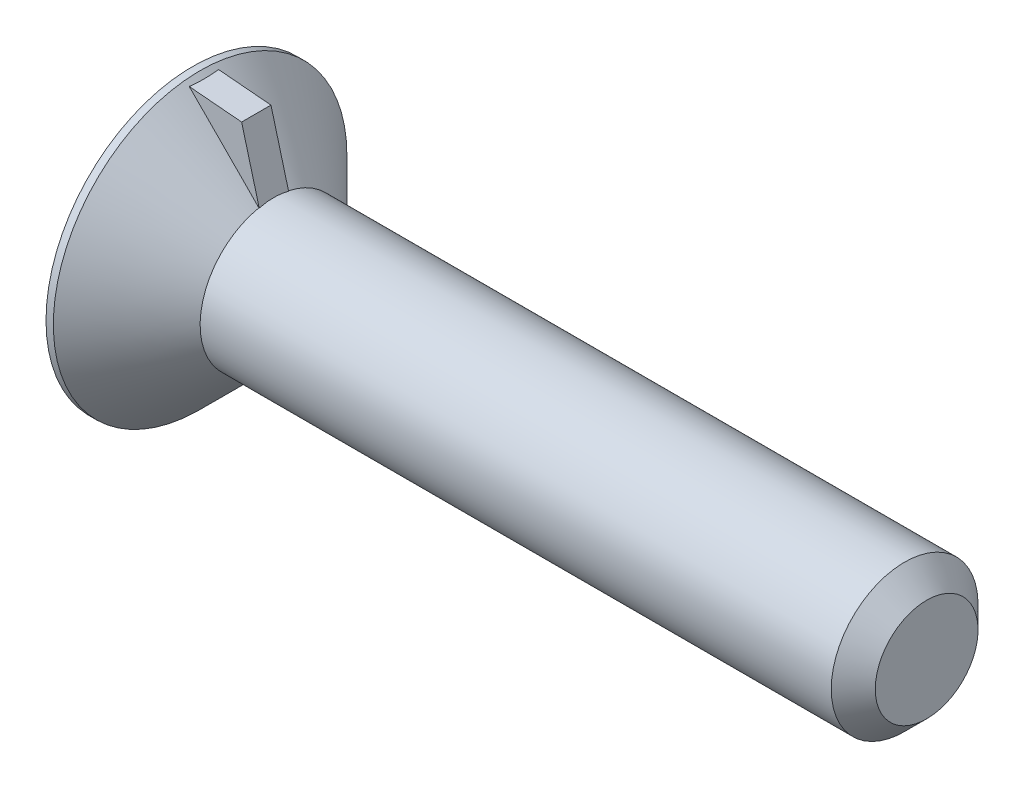
from build123d import *

# Parameters (mm, degrees)
KEY_DEPTH = 1


with BuildPart() as part:
    # BaseBodySke → BaseBody (revolve)
    with BuildSketch(Plane.XY):
        Polygon((0, 0), (0, 10), (0.5, 10), (5.5, 5), (50, 5), (50, 0), align=None)
    revolve(axis=Axis((50, 0, 0), (-1, 0, 0)))

    # FlatEndSke → FlatEnd (revolve, cut)
    with BuildSketch(Plane.XY):
        Polygon((48.5, 5), (50, 5), (50, 3.5), align=None)
    revolve(axis=Axis((0, 0, 0), (1, 0, 0)), mode=Mode.SUBTRACT)

    # KeySke → Key (add, symmetric)
    with BuildSketch(Plane.XY):
        Polygon((0, 9.756097561), (0, 0), (6.839745962, 0), (4.327044308, 9.377530237), align=None)
    extrude(amount=KEY_DEPTH, both=True)


solid = part.part
